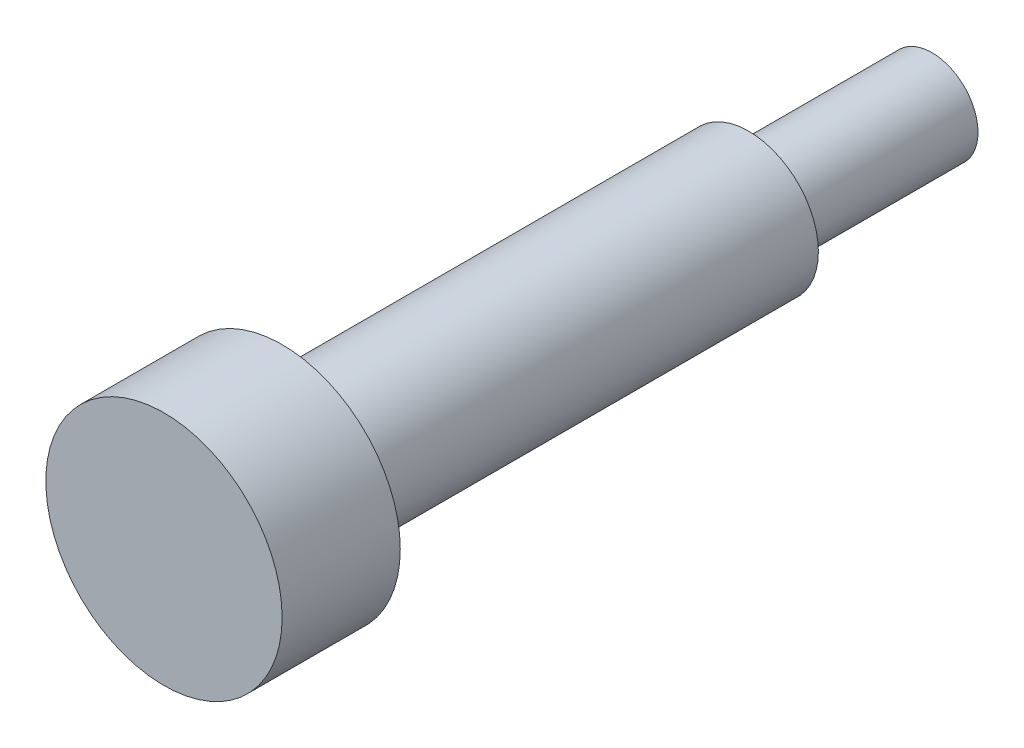
from build123d import *

# Parameters (mm, degrees)
SKETCH1_R           = 1.9808444
BOSS_EXTRUDE1_DEPTH = 7.874
SKETCH2_R           = 1.143
CUT_EXTRUDE2_DEPTH  = 9.357473606
SKETCH3_R           = 2.99147738
BOSS_EXTRUDE2_DEPTH = 20.066
SKETCH4_R           = 5.08
BOSS_EXTRUDE3_DEPTH = 5.08


with BuildPart() as part:
    # Sketch1 → Boss-Extrude1 (new body)
    with BuildSketch(Plane.XY):
        Circle(SKETCH1_R)
    extrude(amount=BOSS_EXTRUDE1_DEPTH)

    # Sketch2 → Cut-Extrude2 (cut, through all)
    with BuildSketch(Plane(origin=(0, 0, 0), x_dir=(-1, 0, 0), z_dir=(0, 0, -1))):
        Circle(SKETCH2_R)
    extrude(amount=-CUT_EXTRUDE2_DEPTH, mode=Mode.SUBTRACT)

    # Sketch3 → Boss-Extrude2 (add)
    with BuildSketch(Plane.XY.offset(7.874)):
        Circle(SKETCH3_R)
    extrude(amount=BOSS_EXTRUDE2_DEPTH)

    # Sketch4 → Boss-Extrude3 (add)
    with BuildSketch(Plane.XY.offset(27.94)):
        Circle(SKETCH4_R)
    extrude(amount=BOSS_EXTRUDE3_DEPTH)


solid = part.part
